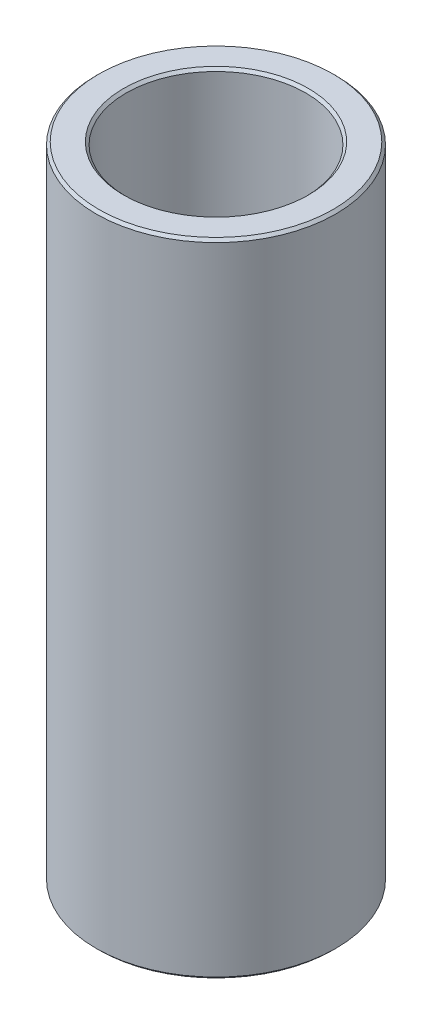
from build123d import *

# Parameters (mm, degrees)
SKETCH1_R           = 40
BOSS_EXTRUDE1_DEPTH = 214.009140005
SKETCH2_R           = 29.96308213
CUT_EXTRUDE1_DEPTH  = 222.359237453
CHAMFER1_SIZE       = 0.874469643


with BuildPart() as part:
    # Sketch1 → Boss-Extrude1 (new body)
    with BuildSketch(Plane(origin=(0, 0, 0), x_dir=(1, 0, 0), z_dir=(0, 1, 0))):
        Circle(SKETCH1_R)
    extrude(amount=BOSS_EXTRUDE1_DEPTH)

    # Sketch2 → Cut-Extrude1 (cut, through all)
    with BuildSketch(Plane(origin=(0, 0, 0), x_dir=(1, 0, 0), z_dir=(0, 1, 0))):
        Circle(SKETCH2_R)
    extrude(amount=CUT_EXTRUDE1_DEPTH, mode=Mode.SUBTRACT)

    # Chamfer1
    chamfer1_edges = [part.edges().sort_by_distance(p)[0] for p in [
        (-29.96308213, 214.009140005, 0),
        (-29.96308213, 0, 0),
        (-40, 0, 0),
        (-40, 214.009140005, 0),
    ]]
    chamfer(chamfer1_edges, length=CHAMFER1_SIZE)


solid = part.part
